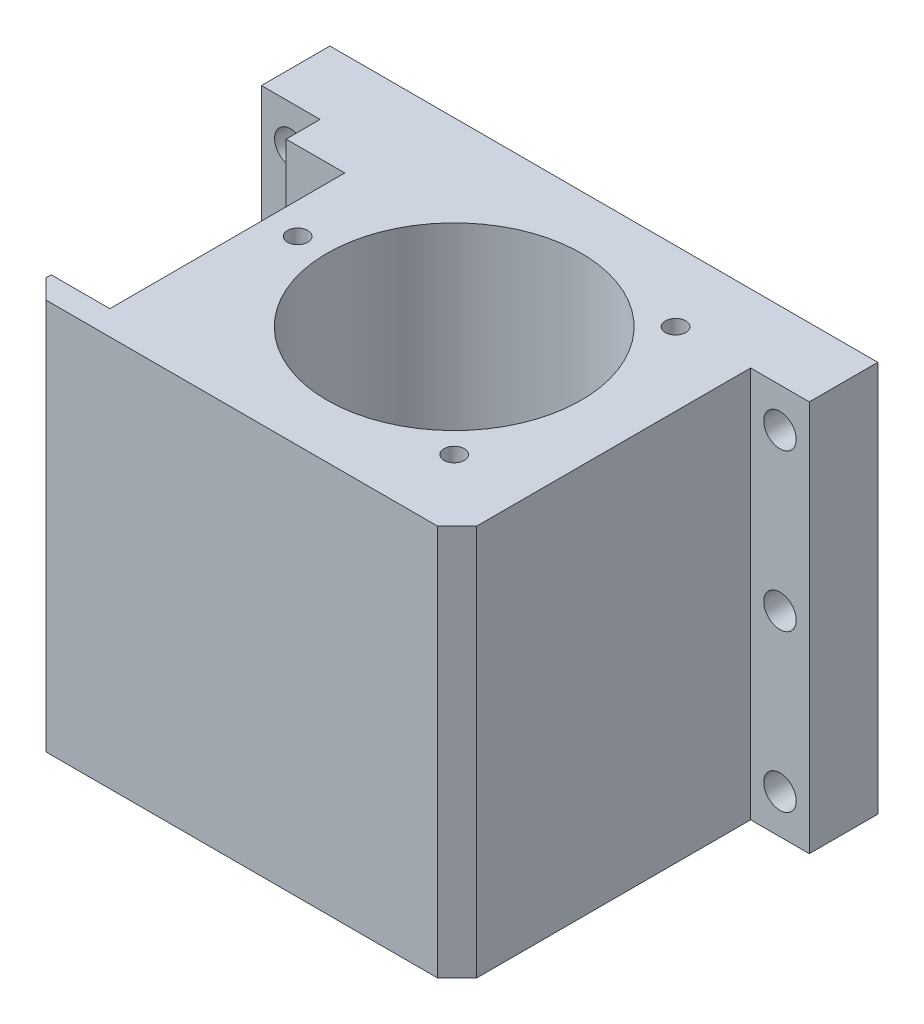
from build123d import *

# Parameters (mm, degrees)
SKETCH_1_W           = 140
SKETCH_1_H           = 100
EXTRUDE_1_DEPTH      = 92.5
SKETCH_2_R           = 32.51
CUT_EXTRUDE_1_DEPTH  = 196.336248556
SKETCH_3_OUTSIDE_W   = 181.068
SKETCH_3_OUTSIDE_H   = 141.068
SKETCH_3_OUTSIDE_W_2 = 110
SKETCH_3_OUTSIDE_H_2 = 100
CUT_EXTRUDE_2_DEPTH  = 75
SKETCH_5_W           = 60.05
SKETCH_5_H           = 100
CUT_EXTRUDE_3_DEPTH  = 15
CHAMFER_2_SIZE       = 5
SKETCH_6_R           = 2.6
CUT_EXTRUDE_4_DEPTH  = 20
SKETCH_9_R           = 4.15
CUT_EXTRUDE_5_DEPTH  = 188.683243791
SKETCH_10_R          = 2.6
CUT_EXTRUDE_6_DEPTH  = 20


with BuildPart() as part:
    # 草图1 → 凸台-拉伸1 (new body)
    with BuildSketch(Plane.XY):
        with Locations((70, -50)):
            Rectangle(SKETCH_1_W, SKETCH_1_H)
    extrude(amount=EXTRUDE_1_DEPTH)

    # 草图2 → 切除-拉伸1 (cut, through all)
    with BuildSketch(Plane(origin=(0, 0, 0), x_dir=(1, 0, 0), z_dir=(0, 1, 0))):
        with Locations((78, -46.25)):
            Circle(SKETCH_2_R)
    extrude(amount=-CUT_EXTRUDE_1_DEPTH, mode=Mode.SUBTRACT)

    # 草图3 outside → 切除-拉伸2 (cut)
    with BuildSketch(Plane.XY.offset(92.5)):
        with Locations((70, -50)):
            Rectangle(SKETCH_3_OUTSIDE_W, SKETCH_3_OUTSIDE_H)
        with Locations((70, -50)):
            Rectangle(SKETCH_3_OUTSIDE_W_2, SKETCH_3_OUTSIDE_H_2, mode=Mode.SUBTRACT)
    extrude(amount=-CUT_EXTRUDE_2_DEPTH, mode=Mode.SUBTRACT)

    # 草图5 → 切除-拉伸3 (cut)
    with BuildSketch(Plane.ZY.offset(-15)):
        with Locations((56.225, -50)):
            Rectangle(SKETCH_5_W, SKETCH_5_H)
    extrude(amount=-CUT_EXTRUDE_3_DEPTH, mode=Mode.SUBTRACT)

    # 倒角2
    chamfer_2_edges = [part.edges().sort_by_distance(p)[0] for p in [
        (125, -50, 92.5),
        (15, -50, 92.5),
    ]]
    chamfer(chamfer_2_edges, length=CHAMFER_2_SIZE)

    # 草图6 → 切除-拉伸4 (cut)
    with BuildSketch(Plane.XZ.offset(100)):
        with Locations((78, 85.75)):
            Circle(SKETCH_6_R)
        with Locations((112.208003449, 66)):
            Circle(SKETCH_6_R)
        with Locations((112.208003449, 26.5)):
            Circle(SKETCH_6_R)
        with Locations((78, 6.75)):
            Circle(SKETCH_6_R)
        with Locations((43.791996551, 26.5)):
            Circle(SKETCH_6_R)
        with Locations((43.791996551, 66)):
            Circle(SKETCH_6_R)
    extrude(amount=-CUT_EXTRUDE_4_DEPTH, mode=Mode.SUBTRACT)

    # 草图9 → 切除-拉伸5 (cut, through all)
    with BuildSketch(Plane.XY.offset(17.5)):
        with Locations((7.5, -10)):
            Circle(SKETCH_9_R)
        with Locations((132.5, -10)):
            Circle(SKETCH_9_R)
        with Locations((132.5, -50)):
            Circle(SKETCH_9_R)
        with Locations((132.5, -90)):
            Circle(SKETCH_9_R)
        with Locations((7.5, -50)):
            Circle(SKETCH_9_R)
        with Locations((7.5, -90)):
            Circle(SKETCH_9_R)
    extrude(amount=-CUT_EXTRUDE_5_DEPTH, mode=Mode.SUBTRACT)

    # 草图10 → 切除-拉伸6 (cut)
    with BuildSketch(Plane(origin=(0, 0, 0), x_dir=(1, 0, 0), z_dir=(0, 1, 0))):
        with Locations((106.284271247, -17.965728753)):
            Circle(SKETCH_10_R)
        with Locations((106.284271247, -74.534271247)):
            Circle(SKETCH_10_R)
        with Locations((38, -46.25)):
            Circle(SKETCH_10_R)
    extrude(amount=-CUT_EXTRUDE_6_DEPTH, mode=Mode.SUBTRACT)


solid = part.part
